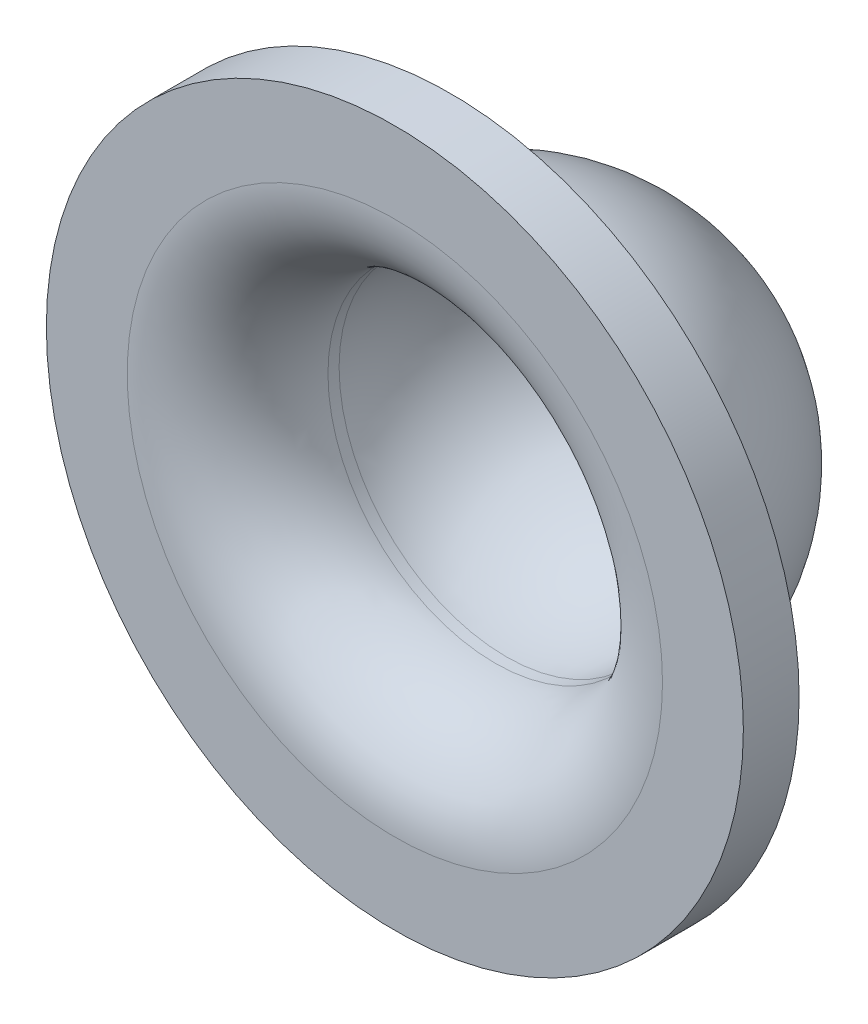
from build123d import *


# Read off the part's stored shape, not the designer's step: Оболочка1
with BuildPart() as part:
    # Эскиз1 → Повернуть1 (revolve)
    with BuildSketch(Plane(origin=(0, 0, 0), x_dir=(1, 0, 0), z_dir=(0, 1, 0))):
        with BuildLine():
            Line((0, 6), (0, 1))
            Line((0, 1), (3.872983346, 1))
            ThreePointArc((3.872983346, 1), (3.968118785, 1.49598283), (4, 2))
            ThreePointArc((4, 2), (2.828427125, 4.828427125), (0, 6))
        make_face()
        with BuildLine():
            Line((3.872983346, 1), (0, 1))
            Line((0, 1), (0, 0))
            Line((0, 0), (3.464101615, 0))
            ThreePointArc((3.464101615, 0), (3.702459174, 0.486132084), (3.872983346, 1))
        make_face()
        with BuildLine():
            ThreePointArc((4, 2), (3.968118785, 1.49598283), (3.872983346, 1))
            ThreePointArc((3.872983346, 1), (3.702459174, 0.486132084), (3.464101615, 0))
            Line((3.464101615, 0), (6.25, 0))
            Line((6.25, 0), (6.25, 1))
            Line((6.25, 1), (4.8, 1))
            ThreePointArc((4.8, 1), (4.234314575, 1.234314575), (4, 1.8))
            Line((4, 1.8), (4, 2))
        make_face()
    revolve(axis=Axis((0, 0, -1), (0, 0, -1)))

    # Оболочка1 outline → Оболочка1 (revolve, cut)
    with BuildSketch(Plane.XZ):
        with BuildLine():
            ThreePointArc((3, -1.8), (3.527207794, -0.527207794), (4.8, 0))
            Line((4.8, 0), (0, 0))
            Line((0, 0), (0, -5))
            ThreePointArc((0, -5), (2.121320345, -4.121320342), (3, -1.999999997))
            Line((3, -1.999999997), (3, -1.8))
        make_face()
    revolve(axis=Axis((0, 0, 0), (0, 0, 1)), mode=Mode.SUBTRACT)


solid = part.part
